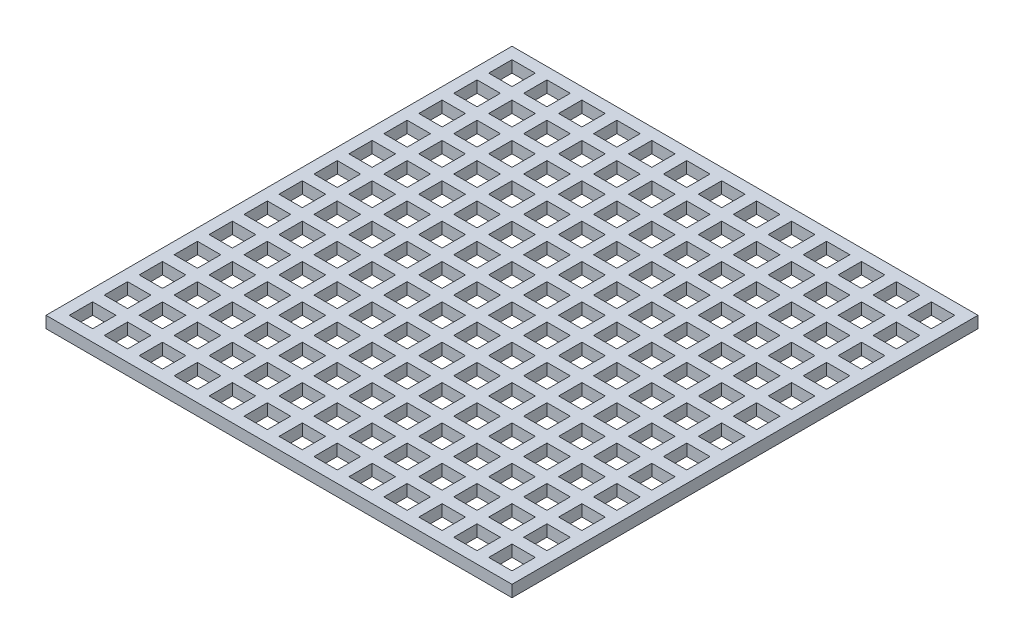
from build123d import *

# Parameters (mm, degrees)
SKETCH1_W            = 50.8
SKETCH1_H            = 50.8
BOSS_EXTRUDE1_DEPTH  = 1.27
CUT_EXTRUDE2_REACH   = 37.943
SKETCH4_W            = 2.54
SKETCH4_H            = 2.54
LPATTERN3_COUNT      = 13
LPATTERN3_PITCH      = 3.81
LPATTERN3_COUNT_DIR2 = 13
LPATTERN3_PITCH_DIR2 = 3.81


with BuildPart() as part:
    # Sketch1 → Boss-Extrude1 (new body)
    with BuildSketch(Plane(origin=(0, 0, 0), x_dir=(1, 0, 0), z_dir=(0, 1, 0))):
        Rectangle(SKETCH1_W, SKETCH1_H)
    extrude(amount=BOSS_EXTRUDE1_DEPTH)

    # Sketch4 → Cut-Extrude2 (cut, up to next)
    with BuildSketch(Plane(origin=(0, 1.27, 0), x_dir=(1, 0, 0), z_dir=(0, 1, 0)), mode=Mode.PRIVATE) as cut_extrude2_sk1:
        with Locations((-22.86, 22.86)):
            Rectangle(SKETCH4_W, SKETCH4_H)
    cut_extrude2_tool1 = extrude(cut_extrude2_sk1.sketch, amount=-CUT_EXTRUDE2_REACH, mode=Mode.PRIVATE) & part.part
    cut_extrude2 = cut_extrude2_tool1.solids().sort_by_distance((-22.86, 1.27, -22.86))[0]
    add(cut_extrude2, mode=Mode.SUBTRACT)

    # LPattern3: Cut-Extrude2 13 × 13
    with Locations(*[(i * LPATTERN3_PITCH, 0, j * LPATTERN3_PITCH_DIR2) for i in range(LPATTERN3_COUNT) for j in range(LPATTERN3_COUNT_DIR2) if (i, j) != (0, 0)]):
        add(cut_extrude2, mode=Mode.SUBTRACT)


solid = part.part
